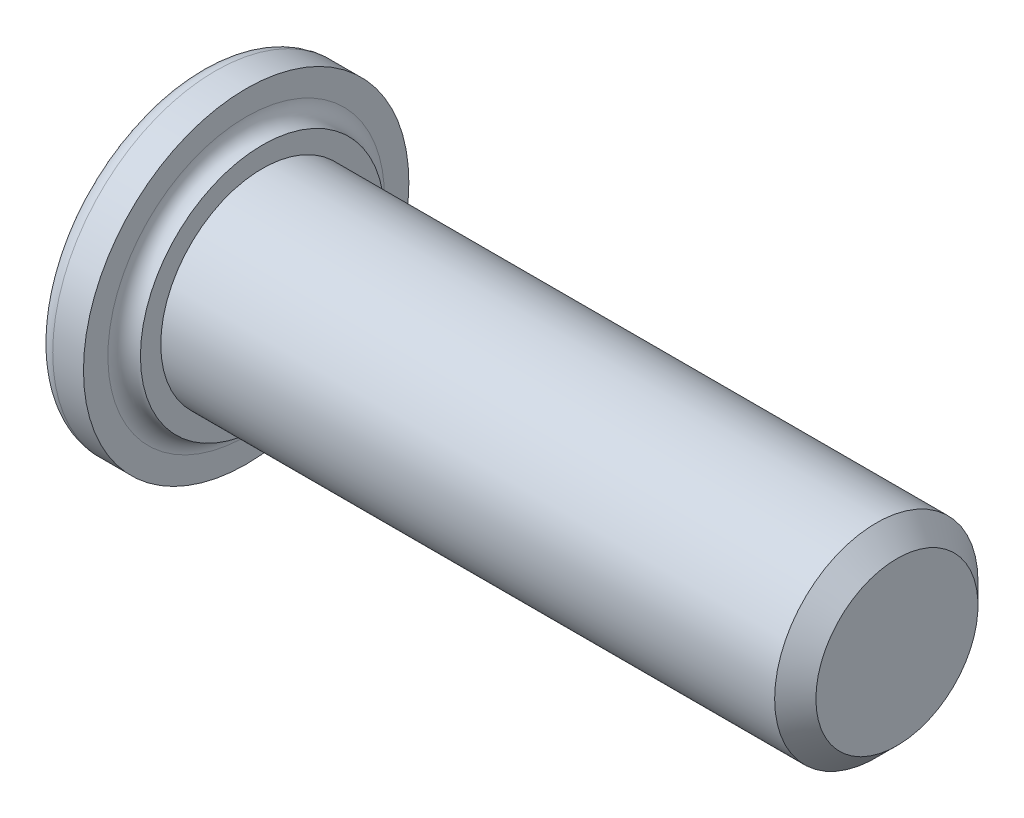
from build123d import *

# Parameters (mm, degrees)
ENL_V_MAT_EXTRU_1_DEPTH = 1
CHANFREIN1_SIZE         = 0.2
CONG_1_R                = 0.2
CONG_2_R                = 0.2


# Read off the part's stored shape, not the designer's step: M2.5 Filetages mécaniques Borne3
with BuildPart() as part:
    # Esquisse1 → Révolution1 (revolve)
    with BuildSketch(Plane.XY):
        with BuildLine():
            Line((0, 0), (-9, 0))
            ThreePointArc((-9, 0), (-8.873105626, 1.030776406), (-8.5, 2))
            Line((-8.5, 2), (-8, 2))
            Line((-8, 2), (-8, 1.5))
            Line((-8, 1.5), (0, 1.5))
            Line((0, 1.5), (0, 0))
        make_face()
    revolve(axis=Axis((0, 0, 0), (-1, 0, 0)))

    # Esquisse2 → Enlèv. mat.-Extru.1 (cut)
    with BuildSketch(Plane.ZY.offset(9)):
        Polygon((-0.25, 1.25), (0.25, 1.25), (0.25, 0.25), (1.25, 0.25), (1.25, -0.25), (0.25, -0.25), (0.25, -1.25), (-0.25, -1.25), (-0.25, -0.25), (-1.25, -0.25), (-1.25, 0.25), (-0.25, 0.25), align=None)
    extrude(amount=-ENL_V_MAT_EXTRU_1_DEPTH, mode=Mode.SUBTRACT)

    # Chanfrein1
    chanfrein1_edges = [part.edges().sort_by_distance(p)[0] for p in [
        (-8.492634293, 0.25, 0.25),
        (-8.492634293, -0.25, 0.25),
        (-8.492634293, -0.25, -0.25),
        (-8.492634293, 0.25, -0.25),
    ]]
    chamfer(chanfrein1_edges, length=CHANFREIN1_SIZE)

    # Enlèv. mat.-Extru.3 cone 1 section (through the dimple's axis) → Enlèv. mat.-Extru.3 (revolve, cut)
    with BuildSketch(Plane(origin=(-8, 0, 0), x_dir=(0, 0, 1), z_dir=(0, 1, 0))):
        Polygon((0, 0), (0.494974747, 0), (0, 0.043304679), align=None)
    revolve(axis=Axis((-8, 0, 0), (1, 0, 0)), mode=Mode.SUBTRACT)

    # Congé1
    cong_1_edges = [part.edges().sort_by_distance(p)[0] for p in [
        (-8, -1.5, 0),
    ]]
    fillet(cong_1_edges, radius=CONG_1_R)

    # Congé2
    cong_2_edges = [part.edges().sort_by_distance(p)[0] for p in [
        (-8.5, -2, 0),
    ]]
    fillet(cong_2_edges, radius=CONG_2_R)

    # M2.5 Filetages mécaniques Borne3 outline → M2.5 Filetages mécaniques Borne3 (revolve, cut)
    with BuildSketch(Plane.YX):
        Polygon((1.5, 0), (0.9965, 0), (1.25, -0.2535), (1.25, -7.8), (1.5, -7.8), align=None)
    revolve(axis=Axis((0, 0, 0), (1, 0, 0)), mode=Mode.SUBTRACT)


solid = part.part
